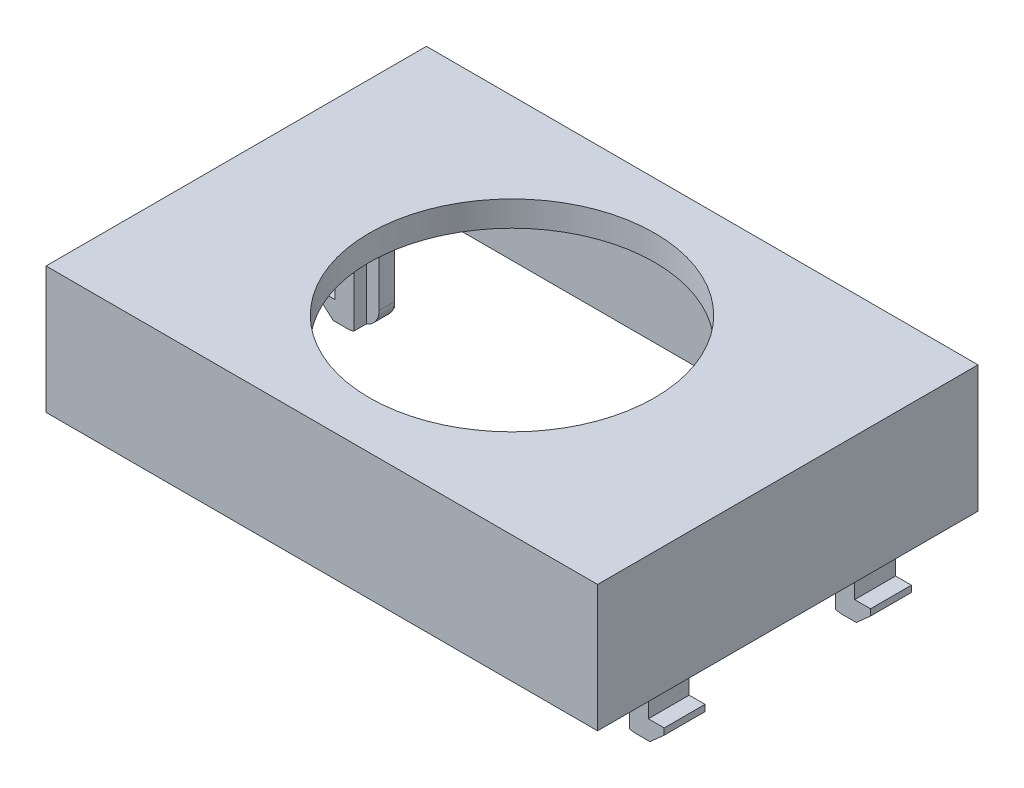
from build123d import *

# Parameters (mm, degrees)
SKETCH1_W            = 87
SKETCH1_H            = 60
BOSS_EXTRUDE1_DEPTH  = 20
SKETCH2_R            = 22.5
CUT_EXTRUDE1_DEPTH   = 20
SKETCH3_W            = 82
SKETCH3_H            = 55
CUT_EXTRUDE2_DEPTH   = 16
SKETCH4_W            = 6.45
SKETCH4_H            = 23.85
BOSS_EXTRUDE2_DEPTH  = 3
SKETCH5_W            = 2.45
SKETCH5_H            = 19
BOSS_EXTRUDE3_DEPTH  = 2
FILLET5_R            = 3
FILLET7_R            = 2
SKETCH6_W            = 2.45
SKETCH6_H            = 19
BOSS_EXTRUDE4_DEPTH  = 2
FILLET8_R            = 3
FILLET9_R            = 2
SKETCH7_W            = 6.45
SKETCH7_H            = 3
BOSS_EXTRUDE5_DEPTH  = 2.5
SKETCH9_W            = 6.45
SKETCH9_H            = 3
BOSS_EXTRUDE6_DEPTH  = 2.5
CUT_EXTRUDE3_DEPTH   = 81.731271908
SKETCH46_W           = 6.45
SKETCH46_H           = 23.85
BOSS_EXTRUDE22_DEPTH = 3
SKETCH47_W           = 2.45
SKETCH47_H           = 19
BOSS_EXTRUDE23_DEPTH = 2
SKETCH48_W           = 2.45
SKETCH48_H           = 19
BOSS_EXTRUDE24_DEPTH = 2
FILLET11_R           = 3
FILLET12_R           = 3
FILLET13_R           = 2
FILLET14_R           = 2
SKETCH49_W           = 6.45
SKETCH49_H           = 3
BOSS_EXTRUDE25_DEPTH = 2.5
SKETCH50_W           = 6.45
SKETCH50_H           = 3
BOSS_EXTRUDE26_DEPTH = 2.5
CUT_EXTRUDE8_DEPTH   = 81.731271908


with BuildPart() as part:
    # Sketch1 → Boss-Extrude1 (new body)
    with BuildSketch(Plane(origin=(0, 0, 0), x_dir=(1, 0, 0), z_dir=(0, 1, 0))):
        with Locations((-17.058139535, -0.906976744)):
            Rectangle(SKETCH1_W, SKETCH1_H)
    extrude(amount=BOSS_EXTRUDE1_DEPTH)

    # Sketch2 → Cut-Extrude1 (cut)
    with BuildSketch(Plane(origin=(0, 20, 0), x_dir=(1, 0, 0), z_dir=(0, 1, 0))):
        with Locations(Location((-17.058139535, -0.906976744, 0), (0, 0, 270))):
            Circle(SKETCH2_R)
    extrude(amount=-CUT_EXTRUDE1_DEPTH, mode=Mode.SUBTRACT)

    # Sketch3 → Cut-Extrude2 (cut)
    with BuildSketch(Plane.XZ):
        with Locations((-17.058139535, 0.906976744)):
            Rectangle(SKETCH3_W, SKETCH3_H)
    extrude(amount=-CUT_EXTRUDE2_DEPTH, mode=Mode.SUBTRACT)

    # Sketch4 → Boss-Extrude2 (add)
    with BuildSketch(Plane.ZY.offset(-23.941860465)):
        with Locations((-15.368023256, 4.075)):
            Rectangle(SKETCH4_W, SKETCH4_H)
        with Locations((17.181976744, 4.075)):
            Rectangle(SKETCH4_W, SKETCH4_H)
    extrude(amount=BOSS_EXTRUDE2_DEPTH)

    # Sketch5 → Boss-Extrude3 (add)
    with BuildSketch(Plane.ZY.offset(-20.941860465)):
        with Locations((-15.368023256, 1.65)):
            Rectangle(SKETCH5_W, SKETCH5_H)
    extrude(amount=BOSS_EXTRUDE3_DEPTH)

    # Fillet5
    fillet5_edges = [part.edges().sort_by_distance(p)[0] for p in [
        (18.941860465, -7.85, -15.368023256),
    ]]
    fillet(fillet5_edges, radius=FILLET5_R)

    # Fillet7
    fillet7_edges = [part.edges().sort_by_distance(p)[0] for p in [
        (18.941860465, 11.15, -15.368023256),
    ]]
    fillet(fillet7_edges, radius=FILLET7_R - 0.0001)  # a hair under: the kernel refuses the full size

    # Sketch6 → Boss-Extrude4 (add)
    with BuildSketch(Plane.ZY.offset(-20.941860465)):
        with Locations((17.181976744, 1.65)):
            Rectangle(SKETCH6_W, SKETCH6_H)
    extrude(amount=BOSS_EXTRUDE4_DEPTH)

    # Fillet8
    fillet8_edges = [part.edges().sort_by_distance(p)[0] for p in [
        (18.941860465, -7.85, 17.181976744),
    ]]
    fillet(fillet8_edges, radius=FILLET8_R)

    # Fillet9
    fillet9_edges = [part.edges().sort_by_distance(p)[0] for p in [
        (18.941860465, 11.15, 17.181976744),
    ]]
    fillet(fillet9_edges, radius=FILLET9_R - 0.0001)  # a hair under: the kernel refuses the full size

    # Sketch7 → Boss-Extrude5 (add)
    with BuildSketch(Plane(origin=(23.941860465, 0, 0), x_dir=(0, 0, -1), z_dir=(1, 0, 0))):
        with Locations((-17.181976744, -6.35)):
            Rectangle(SKETCH7_W, SKETCH7_H)
    extrude(amount=BOSS_EXTRUDE5_DEPTH)

    # Sketch9 → Boss-Extrude6 (add)
    with BuildSketch(Plane(origin=(23.941860465, 0, 0), x_dir=(0, 0, -1), z_dir=(1, 0, 0))):
        with Locations((15.368023256, -6.35)):
            Rectangle(SKETCH9_W, SKETCH9_H)
    extrude(amount=BOSS_EXTRUDE6_DEPTH)

    # Sketch8 → Cut-Extrude3 (cut, through all)
    with BuildSketch(Plane.XY.offset(20.406976744)):
        Polygon((26.441860465, -5.85), (24.191860465, -7.85), (26.441860465, -7.85), align=None)
    extrude(amount=-CUT_EXTRUDE3_DEPTH, mode=Mode.SUBTRACT)

    # Sketch46 → Boss-Extrude22 (add)
    with BuildSketch(Plane(origin=(-58.058139535, 0, 0), x_dir=(0, 0, -1), z_dir=(1, 0, 0))):
        with Locations((-17.181976744, 4.075)):
            Rectangle(SKETCH46_W, SKETCH46_H)
        with Locations((15.368023256, 4.075)):
            Rectangle(SKETCH46_W, SKETCH46_H)
    extrude(amount=BOSS_EXTRUDE22_DEPTH)

    # Sketch47 → Boss-Extrude23 (add)
    with BuildSketch(Plane(origin=(-55.058139535, 0, 0), x_dir=(0, 0, -1), z_dir=(1, 0, 0))):
        with Locations((-17.181976744, 1.65)):
            Rectangle(SKETCH47_W, SKETCH47_H)
    extrude(amount=BOSS_EXTRUDE23_DEPTH)

    # Sketch48 → Boss-Extrude24 (add)
    with BuildSketch(Plane(origin=(-55.058139535, 0, 0), x_dir=(0, 0, -1), z_dir=(1, 0, 0))):
        with Locations((15.368023256, 1.65)):
            Rectangle(SKETCH48_W, SKETCH48_H)
    extrude(amount=BOSS_EXTRUDE24_DEPTH)

    # Fillet11
    fillet11_edges = [part.edges().sort_by_distance(p)[0] for p in [
        (-53.058139535, -7.85, 17.181976744),
    ]]
    fillet(fillet11_edges, radius=FILLET11_R)

    # Fillet12
    fillet12_edges = [part.edges().sort_by_distance(p)[0] for p in [
        (-53.058139535, -7.85, -15.368023256),
    ]]
    fillet(fillet12_edges, radius=FILLET12_R)

    # Fillet13
    fillet13_edges = [part.edges().sort_by_distance(p)[0] for p in [
        (-53.058139535, 11.15, -15.368023256),
    ]]
    fillet(fillet13_edges, radius=FILLET13_R - 0.0001)  # a hair under: the kernel refuses the full size

    # Fillet14
    fillet14_edges = [part.edges().sort_by_distance(p)[0] for p in [
        (-53.058139535, 11.15, 17.181976744),
    ]]
    fillet(fillet14_edges, radius=FILLET14_R - 0.0001)  # a hair under: the kernel refuses the full size

    # Sketch49 → Boss-Extrude25 (add)
    with BuildSketch(Plane.ZY.offset(58.058139535)):
        with Locations((17.181976744, -6.35)):
            Rectangle(SKETCH49_W, SKETCH49_H)
    extrude(amount=BOSS_EXTRUDE25_DEPTH)

    # Sketch50 → Boss-Extrude26 (add)
    with BuildSketch(Plane.ZY.offset(58.058139535)):
        with Locations((-15.368023256, -6.35)):
            Rectangle(SKETCH50_W, SKETCH50_H)
    extrude(amount=BOSS_EXTRUDE26_DEPTH)

    # Sketch52 → Cut-Extrude8 (cut, through all)
    with BuildSketch(Plane(origin=(0, 0, -18.593023256), x_dir=(-1, 0, 0), z_dir=(0, 0, -1))):
        Polygon((60.558139535, -5.85), (58.308139535, -7.85), (60.558139535, -7.85), align=None)
    extrude(amount=-CUT_EXTRUDE8_DEPTH, mode=Mode.SUBTRACT)


solid = part.part
